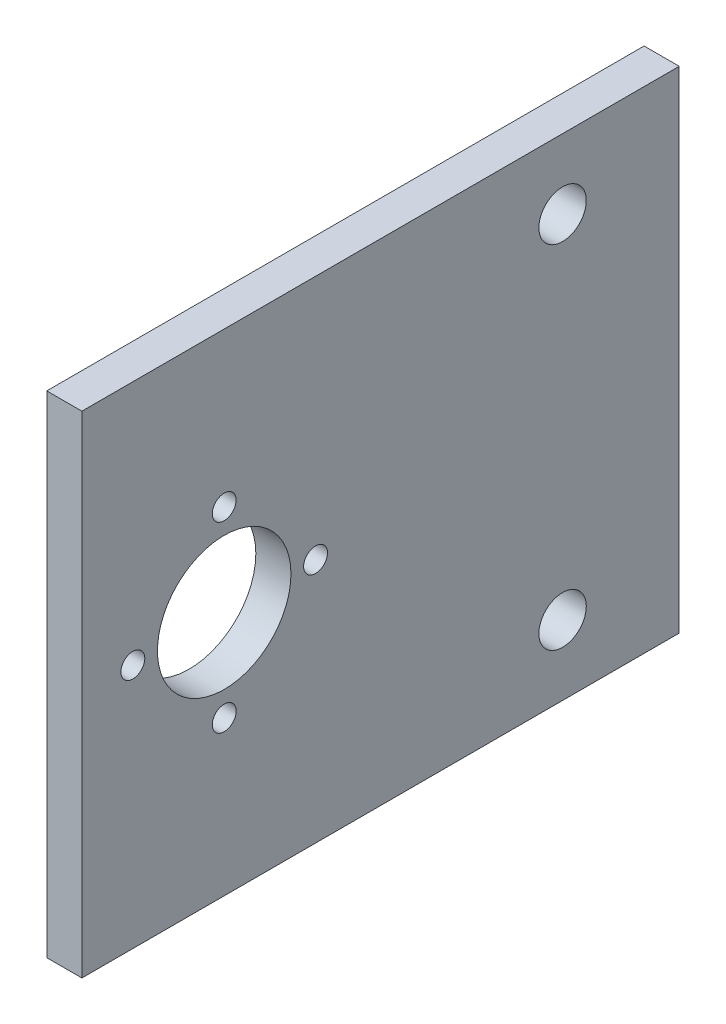
from build123d import *

# Parameters (mm, degrees)
SKETCH1_W           = 69.85
SKETCH1_H           = 85
SKETCH1_R           = 1.7
SKETCH1_R_2         = 9.5
SKETCH1_R_3         = 3.37312
BOSS_EXTRUDE1_DEPTH = 5


with BuildPart() as part:
    # Sketch1 → Boss-Extrude1 (new body)
    with BuildSketch(Plane.YZ):
        Rectangle(SKETCH1_W, SKETCH1_H)
        with Locations((0, 35.25)):
            Circle(SKETCH1_R, mode=Mode.SUBTRACT)
        with Locations((0, 9.25)):
            Circle(SKETCH1_R, mode=Mode.SUBTRACT)
        with Locations((-13, 22.25)):
            Circle(SKETCH1_R, mode=Mode.SUBTRACT)
        with Locations((13, 22.25)):
            Circle(SKETCH1_R, mode=Mode.SUBTRACT)
        with Locations((0, 22.25)):
            Circle(SKETCH1_R_2, mode=Mode.SUBTRACT)
        with Locations((-25, -25.9)):
            Circle(SKETCH1_R_3, mode=Mode.SUBTRACT)
        with Locations((25, -25.9)):
            Circle(SKETCH1_R_3, mode=Mode.SUBTRACT)
    extrude(amount=BOSS_EXTRUDE1_DEPTH)


solid = part.part
